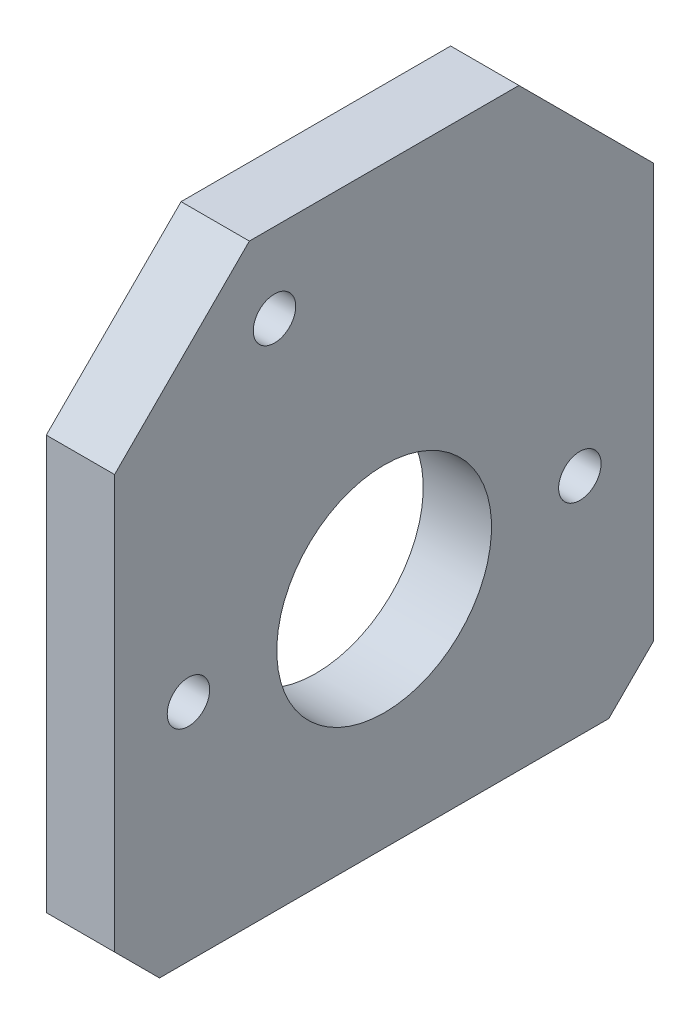
from build123d import *

# Parameters (mm, degrees)
SKETCH1_W                = 38.1
SKETCH1_H                = 41.925
SKETCH1_R                = 7.5875
BOSS_EXTRUDE1_DEPTH      = 4.826
F_3_0_3_DIAMETER_HOLE1_D = 3
CHAMFER1_SIZE            = 9.525
CHAMFER2_SIZE            = 3.175


with BuildPart() as part:
    # Sketch1 → Boss-Extrude1 (new body)
    with BuildSketch(Plane(origin=(0, 0, 0), x_dir=(0, 0, -1), z_dir=(1, 0, 0))):
        with Locations((4.25291004, 9.319846416)):
            Rectangle(SKETCH1_W, SKETCH1_H)
        with Locations((4.25291004, 4.232346416)):
            Circle(SKETCH1_R, mode=Mode.SUBTRACT)
    extrude(amount=BOSS_EXTRUDE1_DEPTH)

    # Ø3.0 (3) Diameter Hole1 (through all)
    with Locations(Plane.ZY):
        with Locations((3.49708996, 24.655740175), (9.576406646, 4.232346416), (-18.082226726, 4.232346416)):
            Hole(F_3_0_3_DIAMETER_HOLE1_D / 2)

    # Chamfer1
    chamfer1_edges = [part.edges().sort_by_distance(p)[0] for p in [
        (2.413, 30.282346416, -23.30291004),
        (2.413, 30.282346416, 14.79708996),
    ]]
    chamfer(chamfer1_edges, length=CHAMFER1_SIZE)

    # Chamfer2
    chamfer2_edges = [part.edges().sort_by_distance(p)[0] for p in [
        (2.413, -11.642653584, 14.79708996),
        (2.413, -11.642653584, -23.30291004),
    ]]
    chamfer(chamfer2_edges, length=CHAMFER2_SIZE)


solid = part.part
